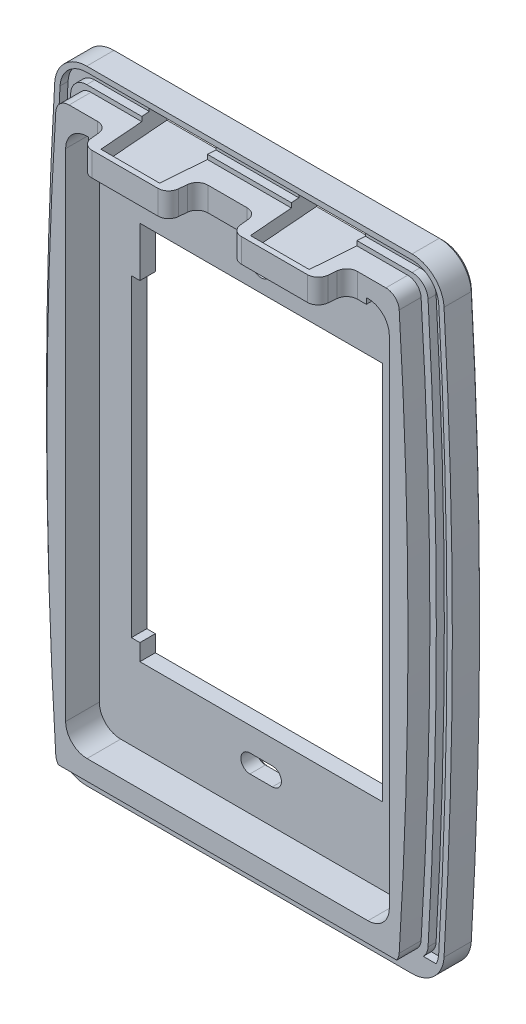
from build123d import *
from OCP.BRepFilletAPI import BRepFilletAPI_MakeChamfer

# Parameters (mm, degrees)
BOSS_EXTRUDE1_DEPTH = 9.8
CUT_EXTRUDE1_START  = -4.1
CUT_EXTRUDE1_DEPTH  = 4.1
SKETCH3_W           = 60.6
SKETCH3_H           = 100.9
CUT_EXTRUDE2_DEPTH  = 6.3
SKETCH4_W           = 1.6
SKETCH4_H           = 58.7
SKETCH4_W_2         = 45.4
SKETCH4_H_2         = 71.1
CUT_EXTRUDE3_DEPTH  = 71.319005255
BOSS_EXTRUDE3_START = -4.5
BOSS_EXTRUDE3_DEPTH = 4.5
CUT_EXTRUDE4_START  = -2.5
CUT_EXTRUDE4_DEPTH  = 4
CUT_EXTRUDE5_START  = -1.7
CUT_EXTRUDE5_DEPTH  = 3.1
FILLET1_R           = 6
FILLET2_R           = 4
FILLET3_R           = 2.5
CUT_EXTRUDE6_DEPTH  = 1.5
CHAMFER1_SIZE       = 1
CHAMFER2_SIZE       = 0.6
CHAMFER2_SIZE2      = 0.651920241
CHAMFER2_SIZE2_2    = 0.691050664
FILLET4_R           = 2


# Read off the part's stored shape, not the designer's step: Boss-Extrude3
with BuildPart() as part:
    # Sketch1 → Boss-Extrude1 (new body)
    with BuildSketch(Plane.XY):
        with BuildLine():
            ThreePointArc((-38, 0), (-37.524874157, -29.190462912), (-36.1, -58.35))
            Line((-36.1, -58.35), (36.1, -58.35))
            ThreePointArc((36.1, -58.35), (37.524874157, -29.190462912), (38, 0))
            ThreePointArc((38, 0), (37.524874157, 29.190462912), (36.1, 58.35))
            Line((36.1, 58.35), (-36.1, 58.35))
            ThreePointArc((-36.1, 58.35), (-37.524874157, 29.190462912), (-38, 0))
        make_face()
    extrude(amount=BOSS_EXTRUDE1_DEPTH)

    # Sketch2 → Cut-Extrude1 (cut)
    with BuildSketch(Plane.XY.offset(9.8).offset(CUT_EXTRUDE1_START)):
        with BuildLine():
            ThreePointArc((36.1, -58.35), (38, 0), (36.1, 58.35))
            Line((36.1, 58.35), (-36.1, 58.35))
            ThreePointArc((-36.1, 58.35), (-38, 0), (-36.1, -58.35))
            Line((-36.1, -58.35), (36.1, -58.35))
        make_face()
        with BuildLine():
            Line((-32, 54.5), (32, 54.5))
            ThreePointArc((32, 54.5), (33.8, 0), (32, -54.5))
            Line((32, -54.5), (-32, -54.5))
            ThreePointArc((-32, -54.5), (-33.8, 0), (-32, 54.5))
        make_face(mode=Mode.SUBTRACT)
    extrude(amount=CUT_EXTRUDE1_DEPTH, mode=Mode.SUBTRACT)

    # Sketch3 → Cut-Extrude2 (cut)
    with BuildSketch(Plane.XY.offset(9.8)):
        with Locations((0, 0.65)):
            Rectangle(SKETCH3_W, SKETCH3_H)
    extrude(amount=-CUT_EXTRUDE2_DEPTH, mode=Mode.SUBTRACT)

    # Sketch4 → Cut-Extrude3 (cut, through all)
    with BuildSketch(Plane(origin=(0, 0, 0), x_dir=(-1, 0, 0), z_dir=(0, 0, -1))):
        with Locations((23.5, -3)):
            Rectangle(SKETCH4_W, SKETCH4_H)
        with Locations((0, 0.1)):
            Rectangle(SKETCH4_W_2, SKETCH4_H_2)
        with BuildLine():
            Line((-2.1, -43.35), (2.1, -43.35))
            ThreePointArc((2.1, -43.35), (3.8, -41.65), (2.1, -39.95))
            Line((2.1, -39.95), (-2.1, -39.95))
            ThreePointArc((-2.1, -39.95), (-3.8, -41.65), (-2.1, -43.35))
        make_face()
        with BuildLine():
            Line((1.7, 39.85), (1.7, 44.05))
            ThreePointArc((1.7, 44.05), (0, 45.75), (-1.7, 44.05))
            Line((-1.7, 44.05), (-1.7, 39.85))
            ThreePointArc((-1.7, 39.85), (0, 38.15), (1.7, 39.85))
        make_face()
    extrude(amount=-CUT_EXTRUDE3_DEPTH, mode=Mode.SUBTRACT)

    # Boss-Extrude3 outline → Boss-Extrude3 (add)
    with BuildSketch(Plane(origin=(0, 54.5, 0), x_dir=(1, 0, 0), z_dir=(0, 1, 0)).offset(BOSS_EXTRUDE3_START)):
        Polygon((0, -3.5), (0, -9.8), (5.5, -9.8), (6, -15), (22, -15), (22.5, -9.8), (26, -9.8), (26, -3.5), align=None)
    boss_extrude3 = extrude(amount=BOSS_EXTRUDE3_DEPTH)

    # Sketch7 → Cut-Extrude4 (cut)
    with BuildSketch(Plane(origin=(0, 54.5, 0), x_dir=(1, 0, 0), z_dir=(0, 1, 0)).offset(CUT_EXTRUDE4_START)):
        Polygon((19.5, -14), (8.5, -14), (7.346153846, 1), (20.653846154, 1), align=None)
    cut_extrude4 = extrude(amount=CUT_EXTRUDE4_DEPTH, mode=Mode.SUBTRACT)

    # Mirror3: Boss-Extrude3, Cut-Extrude4 across plane
    add(boss_extrude3.mirror(Plane(origin=(0, 0, 0), x_dir=(0, 0, 1), z_dir=(1, 0, 0))))
    add(cut_extrude4.mirror(Plane(origin=(0, 0, 0), x_dir=(0, 0, 1), z_dir=(1, 0, 0))), mode=Mode.SUBTRACT)

    # Sketch8 → Cut-Extrude5 (cut)
    with BuildSketch(Plane.XZ.offset(54.5).offset(CUT_EXTRUDE5_START)):
        Polygon((-20.75, -1), (-19.6, 8.2), (-8.4, 8.2), (-7.25, -1), align=None)
    cut_extrude5 = extrude(amount=CUT_EXTRUDE5_DEPTH, mode=Mode.SUBTRACT)

    # Mirror4: Cut-Extrude5 across plane
    add(cut_extrude5.mirror(Plane(origin=(0, 0, 0), x_dir=(0, 0, 1), z_dir=(1, 0, 0))), mode=Mode.SUBTRACT)

    # Fillet1
    fillet1_edges = [part.edges().sort_by_distance(p)[0] for p in [
        (36.1, 58.35, 2.85),
        (36.1, -58.35, 2.85),
        (-36.1, -58.35, 2.85),
        (-36.1, 58.35, 2.85),
    ]]
    fillet(fillet1_edges, radius=FILLET1_R)

    # Fillet2
    fillet2_edges = [part.edges().sort_by_distance(p)[0] for p in [
        (-30.3, -49.8, 6.65),
        (-30.3, 51.1, 6.65),
        (30.3, 51.1, 6.65),
        (30.3, -49.8, 6.65),
    ]]
    fillet(fillet2_edges, radius=FILLET2_R)

    # Fillet3
    fillet3_edges = [part.edges().sort_by_distance(p)[0] for p in [
        (32, 54.5, 7.75),
        (-32, 54.5, 7.75),
        (-32, -54.5, 7.75),
        (32, -54.5, 7.75),
    ]]
    fillet(fillet3_edges, radius=FILLET3_R)

    # Sketch10 → Cut-Extrude6 (cut)
    with BuildSketch(Plane.XY.offset(5.7)):
        with BuildLine():
            Line((30.460657239, 55.35), (-30.460657239, 55.35))
            ThreePointArc((-30.460657239, 55.35), (-32.518710973, 54.532753955), (-33.455473858, 52.526276553))
            ThreePointArc((-33.455473858, 52.526276553), (-35, 0), (-33.455473858, -52.526276553))
            ThreePointArc((-33.455473858, -52.526276553), (-33.188926222, -53.597617073), (-32.552904835, -54.5))
            Line((-32.552904835, -54.5), (-34.974801677, -54.5))
            ThreePointArc((-34.974801677, -54.5), (-35.303180702, -53.59497651), (-35.45201827, -52.643794255))
            ThreePointArc((-35.45201827, -52.643794255), (-37, 0), (-35.45201827, 52.643794255))
            ThreePointArc((-35.45201827, 52.643794255), (-33.890746795, 55.987923259), (-30.460657239, 57.35))
            Line((-30.460657239, 57.35), (30.460657239, 57.35))
            ThreePointArc((30.460657239, 57.35), (33.890746795, 55.987923259), (35.45201827, 52.643794255))
            ThreePointArc((35.45201827, 52.643794255), (37, 0), (35.45201827, -52.643794255))
            ThreePointArc((35.45201827, -52.643794255), (35.303180702, -53.59497651), (34.974801677, -54.5))
            Line((34.974801677, -54.5), (32.552904835, -54.5))
            ThreePointArc((32.552904835, -54.5), (33.188926222, -53.597617073), (33.455473858, -52.526276553))
            ThreePointArc((33.455473858, -52.526276553), (35, 0), (33.455473858, 52.526276553))
            ThreePointArc((33.455473858, 52.526276553), (32.518710973, 54.532753955), (30.460657239, 55.35))
        make_face()
    extrude(amount=-CUT_EXTRUDE6_DEPTH, mode=Mode.SUBTRACT)

    # Chamfer1
    # the kernel refuses this chamfer: 1 mm, written as the material it takes off along each edge
    with BuildSketch(Plane(origin=(32.228209132, -54.5, 9.8), x_dir=(0, 0.9996219169112968, 0.02749587661058555), z_dir=(-1, 0, 0))) as chamfer1_piece_1:
        Polygon((CHAMFER1_SIZE * 0.999621916911, CHAMFER1_SIZE * 0.0274958766106), (-CHAMFER1_SIZE * 0.0274958766106, CHAMFER1_SIZE * 0.999621916911), (0, 0), align=None)
    extrude(amount=64.456418264, mode=Mode.SUBTRACT)

    # Chamfer2: one chamfer whose edges measure the first distance from different faces: ONE call of the kernel's chamfer builder (chamfer() names one face for all edges)
    chamfer2_edges_1 = [part.edges().sort_by_distance(p)[0] for p in [
        (14, 52, 0),
        (14, 56, 0),
        (-14, 52, 0),
        (-14, 56, 0),
        (-14, -52.8, 0),
        (-14, -55.9, 0),
        (14, -52.8, 0),
        (14, -55.9, 0),
        (0, -58.35, 0),
        (0, 58.35, 0),
        (38, 0, 0),
        (-38, 0, 0),
        (34.576764706, 56.715507911, 0),
        (-34.576764706, 56.715507911, 0),
        (34.576764706, -56.715507911, 0),
        (-34.576764706, -56.715507911, 0),
        (1.7, 41.95, 0),
        (-1.7, 41.95, 0),
        (0, 45.75, 0),
        (0, 38.15, 0),
        (0, -39.95, 0),
        (0, -43.35, 0),
        (-3.8, -41.65, 0),
        (3.8, -41.65, 0),
        (-23.5, -32.35, 0),
        (-22.7, -33.9, 0),
        (0, 35.65, 0),
        (-22.7, 31, 0),
        (-23.5, 26.35, 0),
        (-24.3, -3, 0),
        (22.7, 0.1, 0),
        (0, -35.45, 0),
    ]]
    chamfer2_edges_2 = [part.edges().sort_by_distance(p)[0] for p in [
        (20.576923077, 54, 0),
        (7.423076923, 54, 0),
    ]]
    chamfer2_side_2 = [part.faces().sort_by_distance(p)[0] for p in [
        (0, -56.957344623, 0),
    ]]
    chamfer2_edges_3 = [part.edges().sort_by_distance(p)[0] for p in [
        (-20.576923077, 54, 0),
    ]]
    chamfer2_side_3 = [part.faces().sort_by_distance(p)[0] for p in [
        (-20.098958851, 53.596109806, 6.213534938),
    ]]
    chamfer2_edges_4 = [part.edges().sort_by_distance(p)[0] for p in [
        (-7.423076923, 54, 0),
    ]]
    chamfer2_side_4 = [part.faces().sort_by_distance(p)[0] for p in [
        (-7.901041149, 53.596109806, 6.213534938),
    ]]
    chamfer2_edges_5 = [part.edges().sort_by_distance(p)[0] for p in [
        (-7.375, -54.35, 0),
        (-20.625, -54.35, 0),
    ]]
    chamfer2_side_5 = [part.faces().sort_by_distance(p)[0] for p in [
        (0, -56.957344623, 0),
    ]]
    chamfer2_edges_6 = [part.edges().sort_by_distance(p)[0] for p in [
        (20.625, -54.35, 0),
    ]]
    chamfer2_side_6 = [part.faces().sort_by_distance(p)[0] for p in [
        (20.169382984, -54.214279197, 3.644936131),
    ]]
    chamfer2_edges_7 = [part.edges().sort_by_distance(p)[0] for p in [
        (7.375, -54.35, 0),
    ]]
    chamfer2_side_7 = [part.faces().sort_by_distance(p)[0] for p in [
        (7.830617016, -54.214279197, 3.644936131),
    ]]
    chamfer2 = BRepFilletAPI_MakeChamfer(part.part.solid().wrapped)
    for e in chamfer2_edges_1:
        chamfer2.Add(CHAMFER2_SIZE, e.wrapped)
    for e in chamfer2_edges_2:
        chamfer2.Add(CHAMFER2_SIZE, CHAMFER2_SIZE2, e.wrapped, chamfer2_side_2[0].wrapped)  # the first distance lies on this face
    for e in chamfer2_edges_3:
        chamfer2.Add(CHAMFER2_SIZE, CHAMFER2_SIZE2, e.wrapped, chamfer2_side_3[0].wrapped)  # the first distance lies on this face
    for e in chamfer2_edges_4:
        chamfer2.Add(CHAMFER2_SIZE, CHAMFER2_SIZE2, e.wrapped, chamfer2_side_4[0].wrapped)  # the first distance lies on this face
    for e in chamfer2_edges_5:
        chamfer2.Add(CHAMFER2_SIZE, CHAMFER2_SIZE2_2, e.wrapped, chamfer2_side_5[0].wrapped)  # the first distance lies on this face
    for e in chamfer2_edges_6:
        chamfer2.Add(CHAMFER2_SIZE, CHAMFER2_SIZE2_2, e.wrapped, chamfer2_side_6[0].wrapped)  # the first distance lies on this face
    for e in chamfer2_edges_7:
        chamfer2.Add(CHAMFER2_SIZE, CHAMFER2_SIZE2_2, e.wrapped, chamfer2_side_7[0].wrapped)  # the first distance lies on this face
    add(Compound.cast(chamfer2.Shape()), mode=Mode.REPLACE)

    # Fillet4
    fillet4_edges = [part.edges().sort_by_distance(p)[0] for p in [
        (5.5, 52.25, 9.8),
        (22.5, 52.25, 9.8),
        (22, 52.25, 15),
        (6, 52.25, 15),
        (-22.5, 52.25, 9.8),
        (-5.5, 52.25, 9.8),
        (-6, 52.25, 15),
        (-22, 52.25, 15),
    ]]
    fillet(fillet4_edges, radius=FILLET4_R)


solid = part.part
